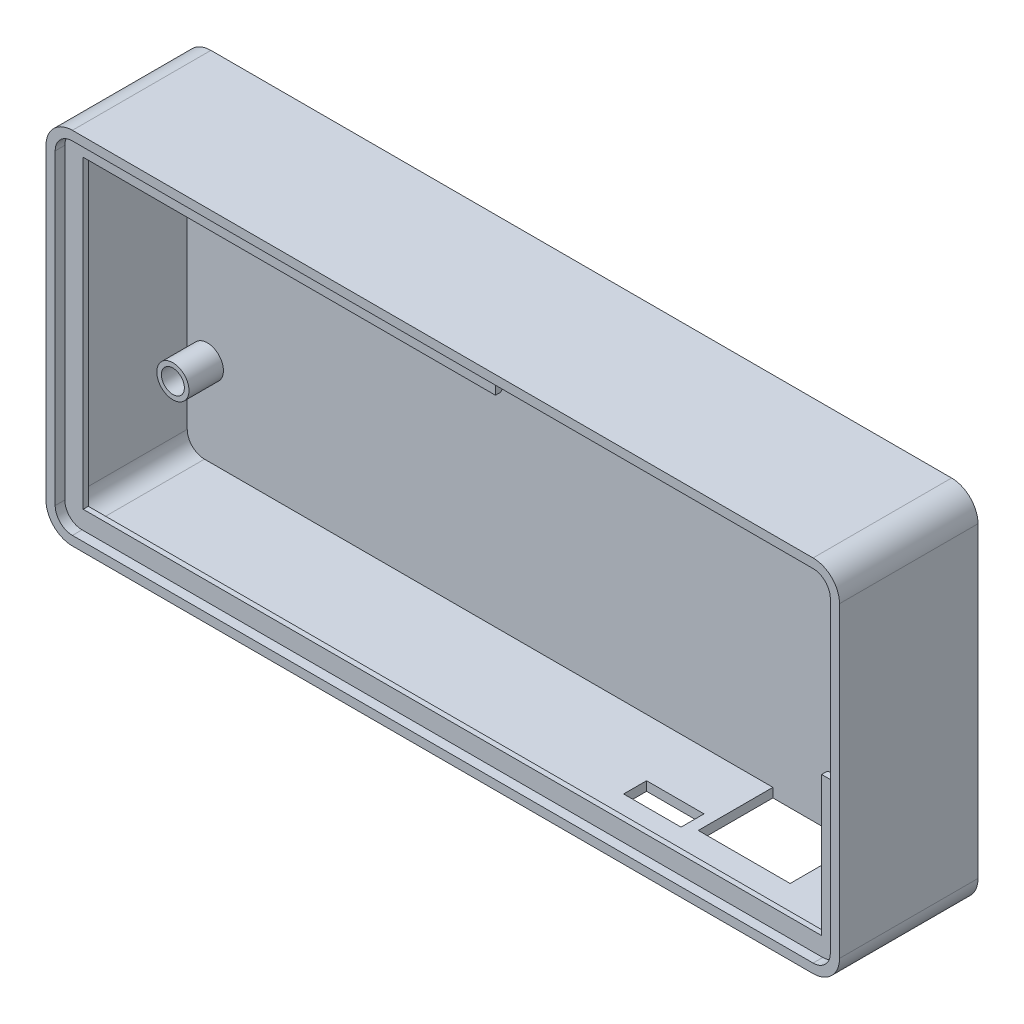
from build123d import *

# Parameters (mm, degrees)
PARED_DEPTH             = 23
CONECTORES_REACH        = 154.052
CROQUIS2_W              = 16
CROQUIS2_H              = 13
CROQUIS2_W_2            = 10
CROQUIS2_H_2            = 4
BASE_START              = -1.12
BASE_FRENTE_DEPTH       = 1.12
LUCES_REACH             = 153.399
CROQUIS3_R              = 2
SALIENTE_EXTRUIR1_START = 12
CROQUIS3_3_R            = 2.8
CROQUIS3_3_R_2          = 2
SALIENTE_EXTRUIR1_DEPTH = 12
SALIENTE_EXTRUIR3_START = 6
CROQUIS3_5_R            = 2.8
CROQUIS3_5_R_2          = 2
SALIENTE_EXTRUIR3_DEPTH = 6
SALIENTE_EXTRUIR4_START = -4.68
SALIENTE_EXTRUIR4_DEPTH = 3


with BuildPart() as part:
    # Croquis1 → pared (new body)
    with BuildSketch(Plane.XY):
        with BuildLine():
            Line((3, 61.1), (132, 61.1))
            ThreePointArc((132, 61.1), (135.252691193, 59.752691193), (136.6, 56.5))
            Line((136.6, 56.5), (136.6, 3))
            ThreePointArc((136.6, 3), (135.252691193, -0.252691193), (132, -1.6))
            Line((132, -1.6), (3, -1.6))
            ThreePointArc((3, -1.6), (-0.252691193, -0.252691193), (-1.6, 3))
            Line((-1.6, 3), (-1.6, 56.5))
            ThreePointArc((-1.6, 56.5), (-0.252691193, 59.752691193), (3, 61.1))
        make_face()
        with BuildLine():
            Line((3, 0), (132, 0))
            ThreePointArc((132, 0), (134.121320344, 0.878679656), (135, 3))
            Line((135, 3), (135, 56.5))
            ThreePointArc((135, 56.5), (134.121320344, 58.621320344), (132, 59.5))
            Line((132, 59.5), (3, 59.5))
            ThreePointArc((3, 59.5), (0.878679656, 58.621320344), (0, 56.5))
            Line((0, 56.5), (0, 3))
            ThreePointArc((0, 3), (0.878679656, 0.878679656), (3, 0))
        make_face(mode=Mode.SUBTRACT)
    extrude(amount=PARED_DEPTH)

    # Croquis2 → conectores (cut, up to next)
    with BuildSketch(Plane.XZ.offset(1.6), mode=Mode.PRIVATE) as conectores_sk1:
        with Locations((110, 6.5)):
            Rectangle(CROQUIS2_W, CROQUIS2_H)
    conectores_tool1 = extrude(conectores_sk1.sketch, amount=-CONECTORES_REACH, mode=Mode.PRIVATE) & part.part
    # Croquis2 → conectores (cut, up to next)
    with BuildSketch(Plane.XZ.offset(1.6), mode=Mode.PRIVATE) as conectores_sk2:
        with Locations((95, 12)):
            Rectangle(CROQUIS2_W_2, CROQUIS2_H_2)
    conectores_tool2 = extrude(conectores_sk2.sketch, amount=-CONECTORES_REACH, mode=Mode.PRIVATE) & part.part
    add(conectores_tool1.solids().sort_by_distance((110, -1.6, 6.5))[0], mode=Mode.SUBTRACT)
    add(conectores_tool2.solids().sort_by_distance((95, -1.6, 12))[0], mode=Mode.SUBTRACT)

    # Croquis1<2> → base frente (add)
    with BuildSketch(Plane.XY.offset(BASE_START)):
        with BuildLine():
            Line((3, 61.1), (132, 61.1))
            ThreePointArc((132, 61.1), (135.252691193, 59.752691193), (136.6, 56.5))
            Line((136.6, 56.5), (136.6, 3))
            ThreePointArc((136.6, 3), (135.252691193, -0.252691193), (132, -1.6))
            Line((132, -1.6), (3, -1.6))
            ThreePointArc((3, -1.6), (-0.252691193, -0.252691193), (-1.6, 3))
            Line((-1.6, 3), (-1.6, 56.5))
            ThreePointArc((-1.6, 56.5), (-0.252691193, 59.752691193), (3, 61.1))
        make_face()
    extrude(amount=BASE_FRENTE_DEPTH)

    # Croquis3 → luces (cut, up to next)
    with BuildSketch(Plane.XY, mode=Mode.PRIVATE) as luces_sk1:
        with Locations((130.5, 48)):
            Circle(CROQUIS3_R)
    luces_tool1 = extrude(luces_sk1.sketch, amount=-LUCES_REACH, mode=Mode.PRIVATE) & part.part
    # Croquis3 → luces (cut, up to next)
    with BuildSketch(Plane.XY, mode=Mode.PRIVATE) as luces_sk2:
        with Locations((130.5, 41.5)):
            Circle(CROQUIS3_R)
    luces_tool2 = extrude(luces_sk2.sketch, amount=-LUCES_REACH, mode=Mode.PRIVATE) & part.part
    # Croquis3 → luces (cut, up to next)
    with BuildSketch(Plane.XY, mode=Mode.PRIVATE) as luces_sk3:
        with Locations((130.5, 35)):
            Circle(CROQUIS3_R)
    luces_tool3 = extrude(luces_sk3.sketch, amount=-LUCES_REACH, mode=Mode.PRIVATE) & part.part
    # Croquis3 → luces (cut, up to next)
    with BuildSketch(Plane.XY, mode=Mode.PRIVATE) as luces_sk4:
        with Locations((130.5, 28.5)):
            Circle(CROQUIS3_R)
    luces_tool4 = extrude(luces_sk4.sketch, amount=-LUCES_REACH, mode=Mode.PRIVATE) & part.part
    # Croquis3 → luces (cut, up to next)
    with BuildSketch(Plane.XY, mode=Mode.PRIVATE) as luces_sk5:
        with Locations((3.5, 15)):
            Circle(CROQUIS3_R)
    luces_tool5 = extrude(luces_sk5.sketch, amount=-LUCES_REACH, mode=Mode.PRIVATE) & part.part
    add(luces_tool1.solids().sort_by_distance((130.5, 48, 0))[0], mode=Mode.SUBTRACT)
    add(luces_tool2.solids().sort_by_distance((130.5, 41.5, 0))[0], mode=Mode.SUBTRACT)
    add(luces_tool3.solids().sort_by_distance((130.5, 35, 0))[0], mode=Mode.SUBTRACT)
    add(luces_tool4.solids().sort_by_distance((130.5, 28.5, 0))[0], mode=Mode.SUBTRACT)
    add(luces_tool5.solids().sort_by_distance((3.5, 15, 0))[0], mode=Mode.SUBTRACT)

    # Croquis3<3> → Saliente-Extruir1 (add)
    # profile 1 of 4: a face of its own
    with BuildSketch(Plane.XY.offset(SALIENTE_EXTRUIR1_START)):
        with Locations((130.5, 28.5)):
            Circle(CROQUIS3_3_R)
        with Locations((130.5, 28.5)):
            Circle(CROQUIS3_3_R_2, mode=Mode.SUBTRACT)
    # profile 2 of 4: a face of its own
    with BuildSketch(Plane.XY.offset(SALIENTE_EXTRUIR1_START)):
        with Locations((130.5, 35)):
            Circle(CROQUIS3_3_R)
        with Locations((130.5, 35)):
            Circle(CROQUIS3_3_R_2, mode=Mode.SUBTRACT)
    # profile 3 of 4: a face of its own
    with BuildSketch(Plane.XY.offset(SALIENTE_EXTRUIR1_START)):
        with Locations((130.5, 41.5)):
            Circle(CROQUIS3_3_R)
        with Locations((130.5, 41.5)):
            Circle(CROQUIS3_3_R_2, mode=Mode.SUBTRACT)
    # profile 4 of 4: a face of its own
    with BuildSketch(Plane.XY.offset(SALIENTE_EXTRUIR1_START)):
        with Locations((130.5, 48)):
            Circle(CROQUIS3_3_R)
        with Locations((130.5, 48)):
            Circle(CROQUIS3_3_R_2, mode=Mode.SUBTRACT)
    extrude(amount=-SALIENTE_EXTRUIR1_DEPTH)

    # Croquis3<5> → Saliente-Extruir3 (add)
    with BuildSketch(Plane.XY.offset(SALIENTE_EXTRUIR3_START)):
        with Locations((3.5, 15)):
            Circle(CROQUIS3_5_R)
        with Locations((3.5, 15)):
            Circle(CROQUIS3_5_R_2, mode=Mode.SUBTRACT)
    extrude(amount=-SALIENTE_EXTRUIR3_DEPTH)

    # Croquis5 → Saliente-Extruir4 (add)
    with BuildSketch(Plane.XY.offset(23).offset(SALIENTE_EXTRUIR4_START)):
        with BuildLine():
            ThreePointArc((3, 59.5), (0.878679656, 58.621320344), (0, 56.5))
            Line((0, 56.5), (0, 3))
            ThreePointArc((0, 3), (0.878679656, 0.878679656), (3, 0))
            Line((3, 0), (132, 0))
            ThreePointArc((132, 0), (134.121320344, 0.878679656), (135, 3))
            Line((135, 3), (135, 27.5))
            Line((135, 27.5), (131.8, 27.5))
            Line((131.8, 27.5), (131.8, 3.2))
            Line((131.8, 3.2), (3.2, 3.2))
            Line((3.2, 3.2), (3.2, 56.3))
            Line((3.2, 56.3), (75, 56.3))
            Line((75, 56.3), (75, 59.5))
            Line((75, 59.5), (3, 59.5))
        make_face()
    extrude(amount=SALIENTE_EXTRUIR4_DEPTH)

    # Chaflán1
    # the kernel refuses this chamfer: 3, 2.100622615 mm, written as the material it takes off along each edge
    with BuildSketch(Plane(origin=(3.2, 56.3, 18.32), x_dir=(0, 0.9997533347641299, -0.022209674198456996), z_dir=(1, 0, 0))) as chafl_n1_piece_1:
        with BuildLine():
            Line((3.099062676, 0), (-0.146456816, 2.166733487))
            Line((-0.146456816, 2.166733487), (-0.206442016, 2.165400906))
            ThreePointArc((-0.206442016, 2.165400906), (-0.084076609, 1.083125749), (-0.0599852, -0.00133258))
            Line((-0.0599852, -0.00133258), (0.00133258, -0.0599852))
            ThreePointArc((0.00133258, -0.0599852), (1.550099582, -0.025579103), (3.100395257, -0.0599852))
            Line((3.100395257, -0.0599852), (3.099062676, 0))
        make_face()
    extrude(amount=71.8, mode=Mode.SUBTRACT)
    with BuildSketch(Plane(origin=(3.2, 3.2, 18.32), x_dir=(-0.9997533347641299, 0, -0.02220967419845701), z_dir=(0, 1, 0))) as chafl_n1_piece_2:
        with BuildLine():
            Line((3.099062676, 0), (-0.146456816, 2.166733487))
            Line((-0.146456816, 2.166733487), (-0.206442016, 2.165400906))
            ThreePointArc((-0.206442016, 2.165400906), (-0.084076609, 1.083125749), (-0.0599852, -0.00133258))
            Line((-0.0599852, -0.00133258), (0.00133258, -0.0599852))
            ThreePointArc((0.00133258, -0.0599852), (1.550099582, -0.025579103), (3.100395257, -0.0599852))
            Line((3.100395257, -0.0599852), (3.099062676, 0))
        make_face()
    extrude(amount=53.1, mode=Mode.SUBTRACT)
    with BuildSketch(Plane(origin=(131.8, 3.2, 18.32), x_dir=(0, -0.99975333476413, -0.022209674198457003), z_dir=(-1, 0, 0))) as chafl_n1_piece_3:
        with BuildLine():
            Line((3.099062676, 0), (-0.146456816, 2.166733487))
            Line((-0.146456816, 2.166733487), (-0.206442016, 2.165400906))
            ThreePointArc((-0.206442016, 2.165400906), (-0.084076609, 1.083125749), (-0.0599852, -0.00133258))
            Line((-0.0599852, -0.00133258), (0.00133258, -0.0599852))
            ThreePointArc((0.00133258, -0.0599852), (1.550099582, -0.025579103), (3.100395257, -0.0599852))
            Line((3.100395257, -0.0599852), (3.099062676, 0))
        make_face()
    extrude(amount=128.6, mode=Mode.SUBTRACT)
    with BuildSketch(Plane(origin=(131.8, 27.5, 18.32), x_dir=(0.9997533347641299, 0, -0.022209674198456996), z_dir=(0, -1, 0))) as chafl_n1_piece_4:
        with BuildLine():
            Line((3.099062676, 0), (-0.146456816, 2.166733487))
            Line((-0.146456816, 2.166733487), (-0.206442016, 2.165400906))
            ThreePointArc((-0.206442016, 2.165400906), (-0.084076609, 1.083125749), (-0.0599852, -0.00133258))
            Line((-0.0599852, -0.00133258), (0.00133258, -0.0599852))
            ThreePointArc((0.00133258, -0.0599852), (1.550099582, -0.025579103), (3.100395257, -0.0599852))
            Line((3.100395257, -0.0599852), (3.099062676, 0))
        make_face()
    extrude(amount=24.3, mode=Mode.SUBTRACT)
    with BuildSketch(Plane(origin=(3.2, 3.2, 18.32), x_dir=(-0.9997533347641299, 0, -0.02220967419845701), z_dir=(0, 1, 0))) as chafl_n1_piece_5a_section:
        with BuildLine():
            Line((3.099062676, 0), (-0.146456816, 2.166733487))
            Line((-0.146456816, 2.166733487), (-0.206442016, 2.165400906))
            ThreePointArc((-0.206442016, 2.165400906), (-0.084076609, 1.083125749), (-0.0599852, -0.00133258))
            Line((-0.0599852, -0.00133258), (0.00133258, -0.0599852))
            ThreePointArc((0.00133258, -0.0599852), (1.550099582, -0.025579103), (3.100395257, -0.0599852))
            Line((3.100395257, -0.0599852), (3.099062676, 0))
        make_face()
    chafl_n1_piece_5a = extrude(amount=60.847656691, mode=Mode.PRIVATE)
    chafl_n1_piece_5a = chafl_n1_piece_5a & Plane(origin=(3, 56.5, 19.031713665), x_dir=(0, 1, 0), z_dir=(0, 0, -1)) * Cylinder(3, 135, mode=Mode.PRIVATE)
    chafl_n1_piece_5a = split(chafl_n1_piece_5a, bisect_by=Plane(origin=(2.281590603, 56.3, 19.031713665), z_dir=(0, 1, 0)), keep=Keep.TOP, mode=Mode.PRIVATE)
    with BuildSketch(Plane(origin=(-4.547656691, 56.3, 18.32), x_dir=(0, 0.9997533347641299, -0.022209674198456996), z_dir=(1, 0, 0))) as chafl_n1_piece_5b_section:
        with BuildLine():
            Line((3.099062676, 0), (-0.146456816, 2.166733487))
            Line((-0.146456816, 2.166733487), (-0.206442016, 2.165400906))
            ThreePointArc((-0.206442016, 2.165400906), (-0.084076609, 1.083125749), (-0.0599852, -0.00133258))
            Line((-0.0599852, -0.00133258), (0.00133258, -0.0599852))
            ThreePointArc((0.00133258, -0.0599852), (1.550099582, -0.025579103), (3.100395257, -0.0599852))
            Line((3.100395257, -0.0599852), (3.099062676, 0))
        make_face()
    chafl_n1_piece_5b = extrude(amount=79.547656691, mode=Mode.PRIVATE)
    chafl_n1_piece_5b = chafl_n1_piece_5b & Plane(origin=(3, 56.5, 19.03171372), x_dir=(0, 1, 0), z_dir=(0, 0, -1)) * Cylinder(3, 172, mode=Mode.PRIVATE)
    chafl_n1_piece_5b = split(chafl_n1_piece_5b, bisect_by=Plane(origin=(3.2, 57.218409394, 19.03171372), z_dir=(-1, 0, 0)), keep=Keep.TOP, mode=Mode.PRIVATE)
    chafl_n1_piece_5 = chafl_n1_piece_5a & chafl_n1_piece_5b
    add(chafl_n1_piece_5, mode=Mode.SUBTRACT)
    with BuildSketch(Plane(origin=(131.8, 3.2, 18.32), x_dir=(0, -0.99975333476413, -0.022209674198457003), z_dir=(-1, 0, 0))) as chafl_n1_piece_6a_section:
        with BuildLine():
            Line((3.099062676, 0), (-0.146456816, 2.166733487))
            Line((-0.146456816, 2.166733487), (-0.206442016, 2.165400906))
            ThreePointArc((-0.206442016, 2.165400906), (-0.084076609, 1.083125749), (-0.0599852, -0.00133258))
            Line((-0.0599852, -0.00133258), (0.00133258, -0.0599852))
            ThreePointArc((0.00133258, -0.0599852), (1.550099582, -0.025579103), (3.100395257, -0.0599852))
            Line((3.100395257, -0.0599852), (3.099062676, 0))
        make_face()
    chafl_n1_piece_6a = extrude(amount=136.347656691, mode=Mode.PRIVATE)
    chafl_n1_piece_6a = chafl_n1_piece_6a & Plane(origin=(3, 3, 19.031713665), x_dir=(-1, 0, 0), z_dir=(0, 0, -1)) * Cylinder(3, 286, mode=Mode.PRIVATE)
    chafl_n1_piece_6a = split(chafl_n1_piece_6a, bisect_by=Plane(origin=(3.2, 2.281590603, 19.031713665), z_dir=(-1, 0, 0)), keep=Keep.TOP, mode=Mode.PRIVATE)
    with BuildSketch(Plane(origin=(3.2, -4.547656691, 18.32), x_dir=(-0.99975333476413, 0, -0.02220967419845701), z_dir=(0, 1, 0))) as chafl_n1_piece_6b_section:
        with BuildLine():
            Line((3.099062676, 0), (-0.146456816, 2.166733487))
            Line((-0.146456816, 2.166733487), (-0.206442016, 2.165400906))
            ThreePointArc((-0.206442016, 2.165400906), (-0.084076609, 1.083125749), (-0.0599852, -0.00133258))
            Line((-0.0599852, -0.00133258), (0.00133258, -0.0599852))
            ThreePointArc((0.00133258, -0.0599852), (1.550099582, -0.025579103), (3.100395257, -0.0599852))
            Line((3.100395257, -0.0599852), (3.099062676, 0))
        make_face()
    chafl_n1_piece_6b = extrude(amount=60.847656691, mode=Mode.PRIVATE)
    chafl_n1_piece_6b = chafl_n1_piece_6b & Plane(origin=(3, 3, 19.03171372), x_dir=(-1, 0, 0), z_dir=(0, 0, -1)) * Cylinder(3, 135, mode=Mode.PRIVATE)
    chafl_n1_piece_6b = split(chafl_n1_piece_6b, bisect_by=Plane(origin=(2.281590606, 3.2, 19.03171372), z_dir=(0, -1, 0)), keep=Keep.TOP, mode=Mode.PRIVATE)
    chafl_n1_piece_6 = chafl_n1_piece_6a & chafl_n1_piece_6b
    add(chafl_n1_piece_6, mode=Mode.SUBTRACT)
    with BuildSketch(Plane(origin=(131.8, 27.5, 18.32), x_dir=(0.9997533347641299, 0, -0.022209674198456996), z_dir=(0, -1, 0))) as chafl_n1_piece_7a_section:
        with BuildLine():
            Line((3.099062676, 0), (-0.146456816, 2.166733487))
            Line((-0.146456816, 2.166733487), (-0.206442016, 2.165400906))
            ThreePointArc((-0.206442016, 2.165400906), (-0.084076609, 1.083125749), (-0.0599852, -0.00133258))
            Line((-0.0599852, -0.00133258), (0.00133258, -0.0599852))
            ThreePointArc((0.00133258, -0.0599852), (1.550099582, -0.025579103), (3.100395257, -0.0599852))
            Line((3.100395257, -0.0599852), (3.099062676, 0))
        make_face()
    chafl_n1_piece_7a = extrude(amount=32.047656691, mode=Mode.PRIVATE)
    chafl_n1_piece_7a = chafl_n1_piece_7a & Plane(origin=(132, 3, 19.031713665), x_dir=(0, -1, 0), z_dir=(0, 0, -1)) * Cylinder(3, 77, mode=Mode.PRIVATE)
    chafl_n1_piece_7a = split(chafl_n1_piece_7a, bisect_by=Plane(origin=(132.718409397, 3.2, 19.031713665), z_dir=(0, -1, 0)), keep=Keep.TOP, mode=Mode.PRIVATE)
    with BuildSketch(Plane(origin=(139.547656691, 3.2, 18.32), x_dir=(0, -0.99975333476413, -0.02220967419845701), z_dir=(-1, 0, 0))) as chafl_n1_piece_7b_section:
        with BuildLine():
            Line((3.099062676, 0), (-0.146456816, 2.166733487))
            Line((-0.146456816, 2.166733487), (-0.206442016, 2.165400906))
            ThreePointArc((-0.206442016, 2.165400906), (-0.084076609, 1.083125749), (-0.0599852, -0.00133258))
            Line((-0.0599852, -0.00133258), (0.00133258, -0.0599852))
            ThreePointArc((0.00133258, -0.0599852), (1.550099582, -0.025579103), (3.100395257, -0.0599852))
            Line((3.100395257, -0.0599852), (3.099062676, 0))
        make_face()
    chafl_n1_piece_7b = extrude(amount=136.347656691, mode=Mode.PRIVATE)
    chafl_n1_piece_7b = chafl_n1_piece_7b & Plane(origin=(132, 3, 19.03171372), x_dir=(0, -1, 0), z_dir=(0, 0, -1)) * Cylinder(3, 286, mode=Mode.PRIVATE)
    chafl_n1_piece_7b = split(chafl_n1_piece_7b, bisect_by=Plane(origin=(131.8, 2.281590606, 19.03171372), z_dir=(1, 0, 0)), keep=Keep.TOP, mode=Mode.PRIVATE)
    chafl_n1_piece_7 = chafl_n1_piece_7a & chafl_n1_piece_7b
    add(chafl_n1_piece_7, mode=Mode.SUBTRACT)


solid = part.part
